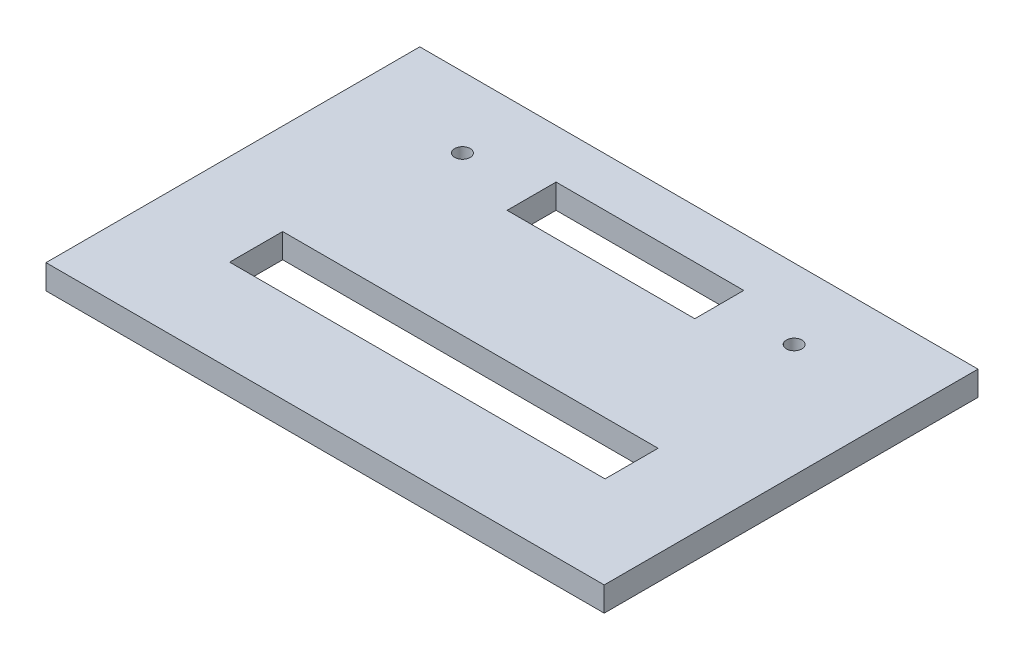
from build123d import *

# Parameters (mm, degrees)
SKETCH1_W           = 68.4
SKETCH1_H           = 45.8
BOSS_EXTRUDE1_DEPTH = 3
SKETCH2_R           = 0.95
CUT_EXTRUDE1_DEPTH  = 42.268026364
SKETCH3_W           = 23
SKETCH3_H           = 6
SKETCH3_W_2         = 46
SKETCH3_H_2         = 6.5
CUT_EXTRUDE2_DEPTH  = 42.268026364


with BuildPart() as part:
    # Sketch1 → Boss-Extrude1 (new body)
    with BuildSketch(Plane(origin=(0, 0, 0), x_dir=(1, 0, 0), z_dir=(0, 1, 0))):
        Rectangle(SKETCH1_W, SKETCH1_H)
    extrude(amount=BOSS_EXTRUDE1_DEPTH)

    # Sketch2 → Cut-Extrude1 (cut, through all)
    with BuildSketch(Plane(origin=(0, 3, 0), x_dir=(1, 0, 0), z_dir=(0, 1, 0))):
        with Locations((-20.32, 14.25)):
            Circle(SKETCH2_R)
        with Locations((20.32, 14.25)):
            Circle(SKETCH2_R)
    extrude(amount=-CUT_EXTRUDE1_DEPTH, mode=Mode.SUBTRACT)

    # Sketch3 → Cut-Extrude2 (cut, through all)
    with BuildSketch(Plane(origin=(0, 3, 0), x_dir=(1, 0, 0), z_dir=(0, 1, 0))):
        with Locations((0, 13.9)):
            Rectangle(SKETCH3_W, SKETCH3_H)
        with Locations((0, -8.35)):
            Rectangle(SKETCH3_W_2, SKETCH3_H_2)
    extrude(amount=-CUT_EXTRUDE2_DEPTH, mode=Mode.SUBTRACT)


solid = part.part
